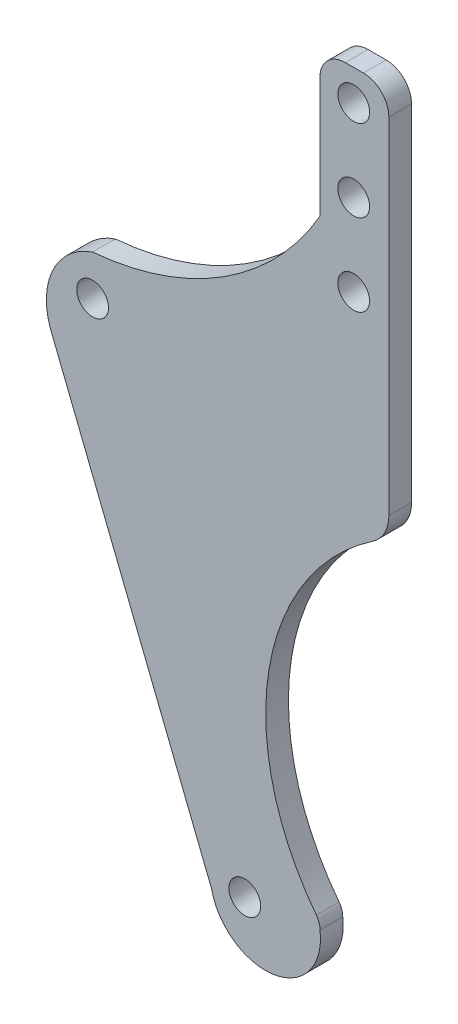
from build123d import *

# Parameters (mm, degrees)
SKETCH1_R           = 2.2225
BOSS_EXTRUDE1_DEPTH = 3.175


with BuildPart() as part:
    # Sketch1 → Boss-Extrude1 (new body)
    with BuildSketch(Plane.XY):
        with BuildLine():
            Line((-23.777707975, 22.847035086), (-23.777707975, 6.125751346))
            ThreePointArc((-23.777707975, 6.125751346), (-23.791648067, 6.020148907), (-23.832513334, 5.92178107))
            ThreePointArc((-23.832513334, 5.92178107), (-37.224155526, -8.021329177), (-55.544078679, -14.196021043))
            ThreePointArc((-55.544078679, -14.196021043), (-61.02275892, -18.993656778), (-61.504330108, -26.260109491))
            Line((-61.504330108, -26.260109491), (-38.909462687, -82.974878491))
            ThreePointArc((-38.909462687, -82.974878491), (-30.087074415, -88.972334518), (-23.75787439, -80.384829605))
            ThreePointArc((-23.75787439, -80.384829605), (-23.88583974, -79.549342433), (-24.280867854, -78.802103023))
            ThreePointArc((-24.280867854, -78.802103023), (-30.912062559, -52.492603109), (-16.357010265, -29.594721511))
            ThreePointArc((-16.357010265, -29.594721511), (-14.726207475, -27.77091559), (-14.137055332, -25.396323935))
            Line((-14.137055332, -25.396323935), (-14.137055332, 22.847035086))
            ThreePointArc((-14.137055332, 22.847035086), (-15.178583618, 25.3615068), (-17.693055332, 26.403035086))
            Line((-17.693055332, 26.403035086), (-20.221707975, 26.403035086))
            ThreePointArc((-20.221707975, 26.403035086), (-22.736179689, 25.3615068), (-23.777707975, 22.847035086))
        make_face()
        with Locations((-55.544078679, -19.824964902)):
            Circle(SKETCH1_R, mode=Mode.SUBTRACT)
        with Locations((-19.05, 22.084955235)):
            Circle(SKETCH1_R, mode=Mode.SUBTRACT)
        with Locations((-19.05, -0.775044765)):
            Circle(SKETCH1_R, mode=Mode.SUBTRACT)
        with Locations((-34.268702177, -81.651111456)):
            Circle(SKETCH1_R, mode=Mode.SUBTRACT)
        with Locations((-19.05, 10.654955235)):
            Circle(SKETCH1_R, mode=Mode.SUBTRACT)
    extrude(amount=BOSS_EXTRUDE1_DEPTH)


solid = part.part
